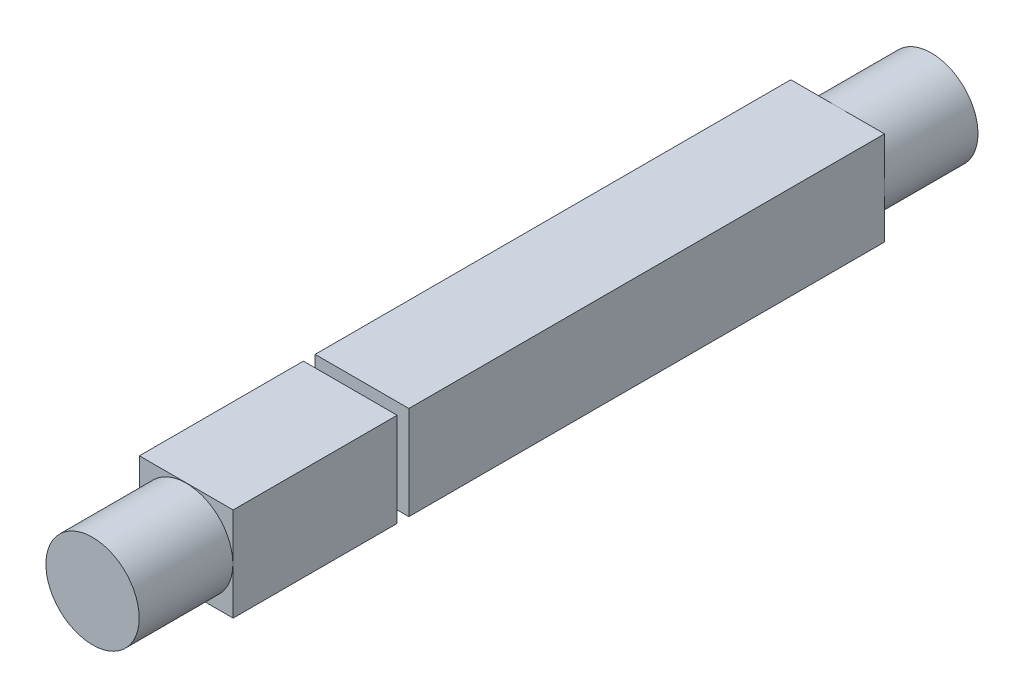
from build123d import *

# Parameters (mm, degrees)
SKETCH1_W           = 4
SKETCH1_H           = 4
BOSS_EXTRUDE1_DEPTH = 13.9
SKETCH2_R           = 1.99
BOSS_EXTRUDE2_DEPTH = 4
CUT_EXTRUDE1_REACH  = 20.45
SKETCH3_W           = 4
SKETCH3_H           = 0.5


with BuildPart() as part:
    # Sketch1 → Boss-Extrude1 (new, symmetric)
    with BuildSketch(Plane.XY):
        Rectangle(SKETCH1_W, SKETCH1_H)
    extrude(amount=BOSS_EXTRUDE1_DEPTH, both=True)

    # Sketch2 → Boss-Extrude2 (add)
    with BuildSketch(Plane.XY.offset(13.9)):
        Circle(SKETCH2_R)
    boss_extrude2 = extrude(amount=BOSS_EXTRUDE2_DEPTH)

    # Mirror2: Boss-Extrude2 across plane
    add(boss_extrude2.mirror(Plane.XY))

    # Sketch3 → Cut-Extrude1 (cut, up to next)
    with BuildSketch(Plane(origin=(0, 2, 0), x_dir=(1, 0, 0), z_dir=(0, 1, 0)), mode=Mode.PRIVATE) as cut_extrude1_sk1:
        with Locations((0, -6.65)):
            Rectangle(SKETCH3_W, SKETCH3_H)
    cut_extrude1_tool1 = extrude(cut_extrude1_sk1.sketch, amount=-CUT_EXTRUDE1_REACH, mode=Mode.PRIVATE) & part.part
    add(cut_extrude1_tool1.solids().sort_by_distance((0, 2, 6.65))[0], mode=Mode.SUBTRACT)


with BuildPart() as cut_extrude1_piece_1:
    # of the separate pieces the step leaves, piece 1, a body of its own (cut_extrude1_pieces)
    add(part.part.solids().sort_by_distance((2, -2, -13.9))[0])


with BuildPart() as cut_extrude1_piece_2:
    # of the separate pieces the step leaves, piece 2, a body of its own (cut_extrude1_pieces)
    add(part.part.solids().sort_by_distance((2, -2, 6.9))[0])


solid = Compound([cut_extrude1_piece_1.part, cut_extrude1_piece_2.part])
